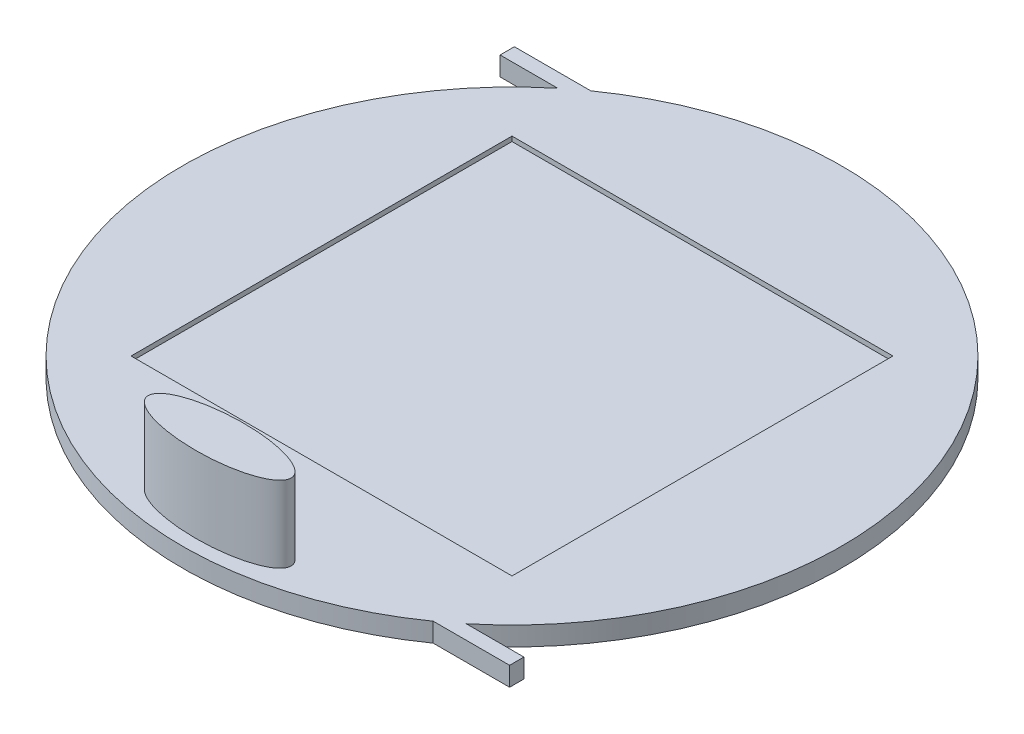
from build123d import *

# Parameters (mm, degrees)
BOSS_EXTRUDE1_DEPTH     = 2
SKETCH3_RX              = 7.5
SKETCH3_RY              = 2.5
BOSS_EXTRUDE2_DEPTH     = 8
SKETCH4_W               = 40
SKETCH4_H               = 40
CUT_EXTRUDE3_DEPTH      = 0.5
CUT_EXTRUDE4_DEPTH      = 22
CUT_EXTRUDE4_DEPTH_BACK = 21
SKETCH1_6_W             = 28
SKETCH1_6_H             = 1.5
EXTRUDE_THIN1_DEPTH     = 2


with BuildPart() as part:
    # Sketch1 → Boss-Extrude1 (new body)
    with BuildSketch(Plane(origin=(0, 0, 0), x_dir=(1, 0, 0), z_dir=(0, 1, 0))):
        with BuildLine():
            ThreePointArc((-20.997857034, 27.5), (-27.5, -20.997857034), (20.997857034, -27.5))
            ThreePointArc((20.997857034, -27.5), (27.5, 20.997857034), (-20.997857034, 27.5))
        make_face()
    extrude(amount=BOSS_EXTRUDE1_DEPTH)

    # Sketch3 → Boss-Extrude2 (add)
    with BuildSketch(Plane(origin=(0, 2, 0), x_dir=(1, 0, 0), z_dir=(0, 1, 0))):
        with Locations((0, -30.694699658)):
            Ellipse(SKETCH3_RX, SKETCH3_RY)
    extrude(amount=BOSS_EXTRUDE2_DEPTH)

    # Sketch4 → Cut-Extrude3 (cut)
    with BuildSketch(Plane(origin=(0, 2, 0), x_dir=(1, 0, 0), z_dir=(0, 1, 0))):
        Rectangle(SKETCH4_W, SKETCH4_H)
    extrude(amount=-CUT_EXTRUDE3_DEPTH, mode=Mode.SUBTRACT)

    # Sketch7 → Cut-Extrude4 (cut, two sides: drawn at the far end of the back side and taken through both)
    with BuildSketch(Plane.XY.offset(-CUT_EXTRUDE4_DEPTH_BACK)):
        Polygon((-34.6, 1), (-29.75, 0), (-34.6, 0), align=None)
    extrude(amount=CUT_EXTRUDE4_DEPTH + CUT_EXTRUDE4_DEPTH_BACK, mode=Mode.SUBTRACT)

    # Sketch1<6> → Extrude-Thin1 (add)
    with BuildSketch(Plane(origin=(0, 0, 0), x_dir=(1, 0, 0), z_dir=(0, 1, 0))):
        with Locations((-14, 27.5)):
            Rectangle(SKETCH1_6_W, SKETCH1_6_H)
        with Locations((14, -27.5)):
            Rectangle(SKETCH1_6_W, SKETCH1_6_H)
    extrude(amount=EXTRUDE_THIN1_DEPTH)


solid = part.part
